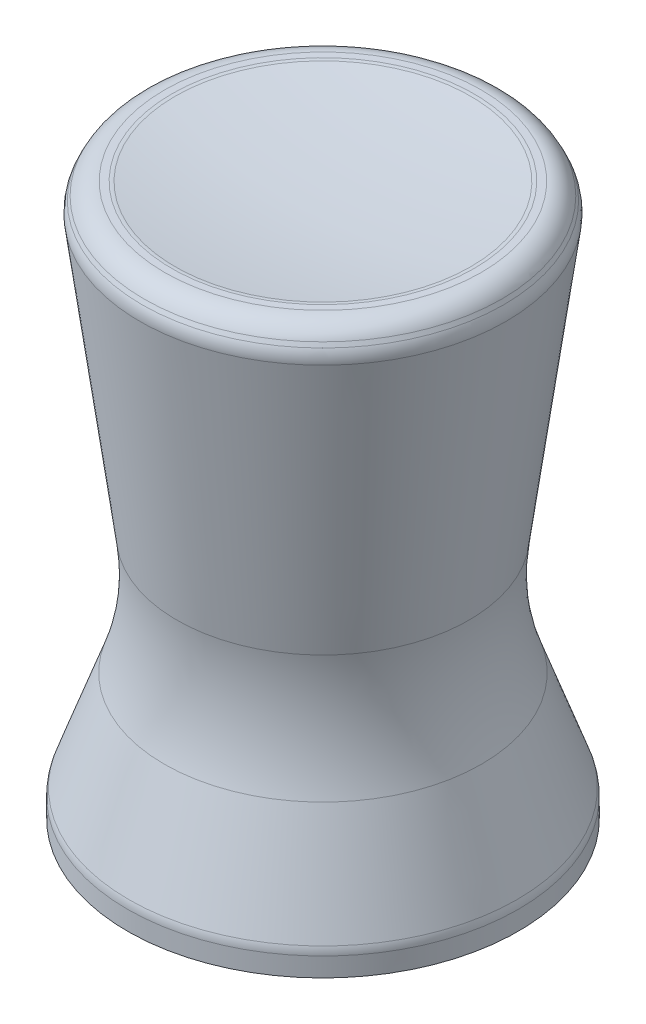
from build123d import *

# Parameters (mm, degrees)
FILLET1_R           = 11
FILLET2_R           = 1
BOSS_EXTRUDE1_DEPTH = 10.425
CHAMFER1_SIZE       = 0.35


with BuildPart() as part:
    # Sketch1 → Revolve1 (revolve)
    with BuildSketch(Plane.XY, mode=Mode.PRIVATE) as revolve1_sk:
        with BuildLine():
            Line((0, 0), (8.5, 0))
            Line((8.5, 0), (8.5, 1))
            Line((8.5, 1), (6, 8))
            Line((6, 8), (8, 23))
            Line((8, 23), (7.5, 24))
            Line((7.5, 24), (6.5, 24))
            add(Edge.make_bspline(
                [(6.5, 24), (3.269230769, 23.5), (0, 23.5)],
                knots=[0, 0, 0, 1, 1, 1], degree=2))
            Line((0, 23.5), (0, 0))
        make_face()
    revolve(revolve1_sk.sketch.rotate(Axis((0, 23.5, 0), (0, -1, 0)), 180), axis=Axis((0, 23.5, 0), (0, -1, 0)))

    # Fillet1
    fillet1_edges = [part.edges().sort_by_distance(p)[0] for p in [
        (6, 8, 0),
    ]]
    fillet(fillet1_edges, radius=FILLET1_R)

    # Fillet2
    fillet2_edges = [part.edges().sort_by_distance(p)[0] for p in [
        (6.5, 24, 0),
        (7.5, 24, 0),
        (8, 23, 0),
        (8.5, 1, 0),
    ]]
    fillet(fillet2_edges, radius=FILLET2_R)

    # Sketch3 → Cut-Revolve1 (revolve, cut)
    with BuildSketch(Plane.XY, mode=Mode.PRIVATE) as cut_revolve1_sk:
        Polygon((0, 0), (3.875, 0), (3.875, 6.5), (3.05, 7.325), (3.05, 17.75), (0, 17.75), align=None)
    revolve(cut_revolve1_sk.sketch.rotate(Axis((0, 17.75, 0), (0, -1, 0)), 180), axis=Axis((0, 17.75, 0), (0, -1, 0)), mode=Mode.SUBTRACT)

    # Sketch4 → Boss-Extrude1 (add)
    with BuildSketch(Plane.XZ.offset(-17.75)):
        with BuildLine():
            Line((-2.655654345, 1.5), (2.655654345, 1.5))
            ThreePointArc((2.655654345, 1.5), (0, 3.05), (-2.655654345, 1.5))
        make_face()
        with BuildLine():
            ThreePointArc((-0.099986562, -3.048360656), (0, -3.05), (0.099986562, -3.048360656))
            ThreePointArc((0.099986562, -3.048360656), (0, -2.95), (-0.099986562, -3.048360656))
        make_face()
    extrude(amount=BOSS_EXTRUDE1_DEPTH)

    # Chamfer1
    # the kernel refuses this chamfer: 0.35 mm, written as the material it takes off along each edge
    with BuildSketch(Plane(origin=(-3.555743391, 7.325, 1.5), x_dir=(0, -0.02749587661058614, 0.9996219169112968), z_dir=(1, 0, 0))) as chamfer1_piece_1_section:
        Polygon((CHAMFER1_SIZE * 0.999621916911, -CHAMFER1_SIZE * 0.0274958766106), (-CHAMFER1_SIZE * 0.0274958766106, -CHAMFER1_SIZE * 0.999621916911), (0, 0), align=None)
    chamfer1_piece_1 = extrude(amount=7.111486782, mode=Mode.PRIVATE)
    chamfer1_piece_1 = chamfer1_piece_1 & Plane(origin=(0, 7.499624527, 0), x_dir=(-1, 0, 0), z_dir=(0, 1, 0)) * Cylinder(3.05, 16, mode=Mode.PRIVATE)
    add(chamfer1_piece_1, mode=Mode.SUBTRACT)


solid = part.part
